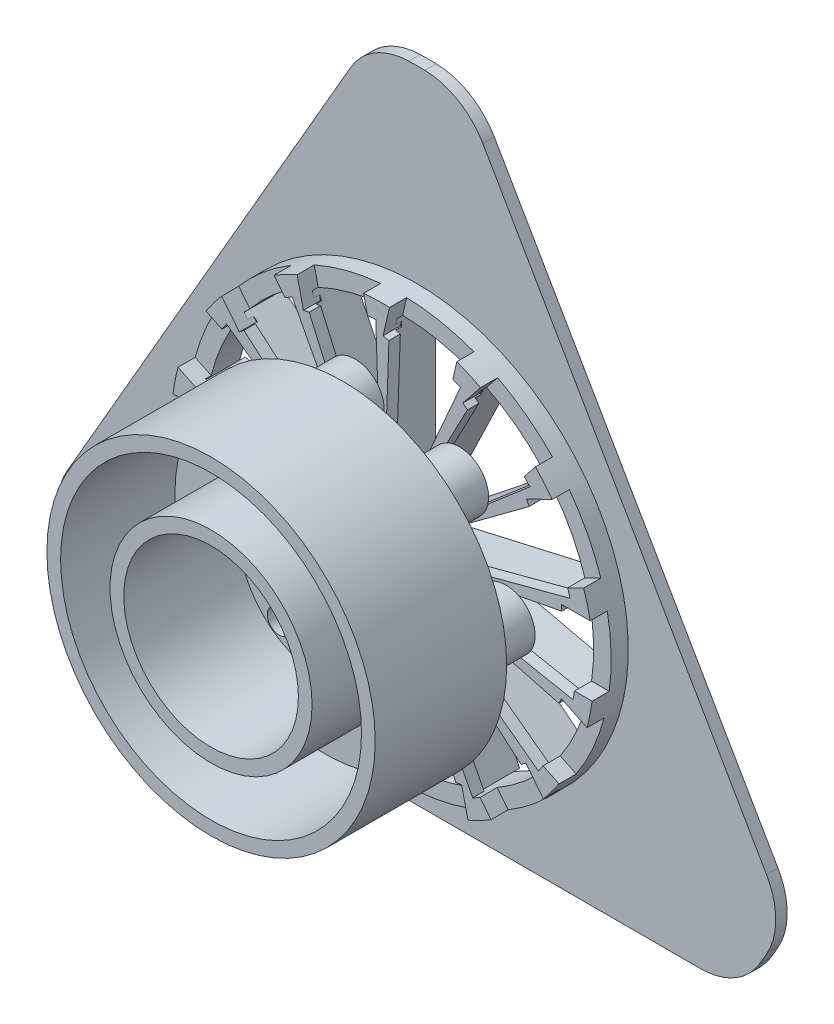
from build123d import *
from build123d.topology import SkipClean

# Parameters (mm, degrees)
SKETCH2_R               = 18.5
BOSS_EXTRUDE10_DEPTH    = 4
SKETCH8_R               = 22.678479032
SKETCH8_R_2             = 21.249376386
BOSS_EXTRUDE11_DEPTH    = 4
SKETCH9_R               = 1.624259049
SKETCH9_R_2             = 1.124259049
SKETCH9_R_3             = 2.552274029
SKETCH9_R_4             = 2.052274029
BOSS_EXTRUDE12_DEPTH    = 5
BOSS_EXTRUDE16_START    = -1.5
SKETCH11_R              = 14.361292765
SKETCH11_R_2            = 8.114913008
SKETCH11_R_3            = 2.552274029
SKETCH11_R_4            = 4.894571286
SKETCH11_R_5            = 2.052274029
BOSS_EXTRUDE16_DEPTH    = 1.5
SKETCH12_R              = 14.361292765
SKETCH12_R_2            = 13.161292765
SKETCH12_R_3            = 8.83789669
SKETCH12_R_4            = 7.63789669
BOSS_EXTRUDE14_DEPTH    = 10
SKETCH13_R              = 1.041112239
SKETCH13_R_2            = 1.221222972
CUT_EXTRUDE2_DEPTH      = 1.5
BOSS_EXTRUDE17_START    = -3
BOSS_EXTRUDE17_DEPTH    = 1
CUT_EXTRUDE4_START      = -2
SKETCH17_W              = 1.972139385
SKETCH17_H              = 6
CUT_EXTRUDE4_DEPTH      = 5
CIRPATTERN1_COUNT       = 14
CUT_EXTRUDE5_DEPTH      = 34.595041634
CUT_EXTRUDE5_DEPTH_BACK = 34.595041634
SKETCH18_R              = 22.678479032
SKETCH18_R_2            = 21.249376386
SKETCH19_R              = 22.100164657
SKETCH19_R_2            = 18.5
BOSS_EXTRUDE18_DEPTH    = 1
BOSS_EXTRUDE2_START     = -1
SKETCH3_R               = 35
SKETCH3_R_2             = 22.100164657
BOSS_EXTRUDE2_DEPTH     = 1
SKETCH4_R               = 2.9
BOSS_EXTRUDE3_DEPTH     = 2
SKETCH6_R               = 5
BOSS_EXTRUDE4_DEPTH     = 1
SKETCH7_R               = 59.131365533
CUT_EXTRUDE1_DEPTH      = 10
FILLET1_R               = 6
BOSS_EXTRUDE19_START    = -0.5
BOSS_EXTRUDE19_DEPTH    = 0.5
BOSS_EXTRUDE20_START    = 0.5
SKETCH21_R              = 3
BOSS_EXTRUDE20_DEPTH    = 0.5


with BuildPart() as part:
    # Sketch2 → Boss-Extrude10 (new body)
    with BuildSketch(Plane.XY.offset(10)):
        Circle(SKETCH2_R)
        with BuildLine():
            Line((-0.15, 16.969746557), (-0.15, 2.996247653))
            ThreePointArc((-0.15, 2.996247653), (-0.667562802, 2.924783737), (-1.164877805, 2.764608417))
            Line((-1.164877805, 2.764608417), (-7.227751758, 15.354295905))
            ThreePointArc((-7.227751758, 15.354295905), (-3.776271369, 16.544925891), (-0.15, 16.969746557))
        make_face(mode=Mode.SUBTRACT)
        with BuildLine():
            Line((-7.498042418, 15.224130783), (-1.435168465, 2.634443295))
            ThreePointArc((-1.435168465, 2.634443295), (-1.870469406, 2.345494447), (-2.249037274, 1.985404578))
            Line((-2.249037274, 1.985404578), (-13.173958637, 10.697738641))
            ThreePointArc((-13.173958637, 10.697738641), (-10.580877249, 13.268000408), (-7.498042418, 15.224130783))
        make_face(mode=Mode.SUBTRACT)
        with BuildLine():
            Line((-13.361005578, 10.463189196), (-2.436084215, 1.750855133))
            ThreePointArc((-2.436084215, 1.750855133), (-2.702906604, 1.301651217), (-2.887747329, 0.812967013))
            Line((-2.887747329, 0.812967013), (-16.510901441, 3.92236304))
            ThreePointArc((-16.510901441, 3.92236304), (-15.289810625, 7.363184723), (-13.361005578, 10.463189196))
        make_face(mode=Mode.SUBTRACT)
        with BuildLine():
            Line((-16.577657721, 3.629884666), (-2.954503609, 0.520488639))
            ThreePointArc((-2.954503609, 0.520488639), (-3, 0), (-2.954503609, -0.520488639))
            Line((-2.954503609, -0.520488639), (-16.577657721, -3.629884666))
            ThreePointArc((-16.577657721, -3.629884666), (-16.970409488, 0), (-16.577657721, 3.629884666))
        make_face(mode=Mode.SUBTRACT)
        with BuildLine():
            Line((-16.510901441, -3.92236304), (-2.887747329, -0.812967013))
            ThreePointArc((-2.887747329, -0.812967013), (-2.702906604, -1.301651217), (-2.436084215, -1.750855133))
            Line((-2.436084215, -1.750855133), (-13.361005578, -10.463189196))
            ThreePointArc((-13.361005578, -10.463189196), (-15.289810625, -7.363184723), (-16.510901441, -3.92236304))
        make_face(mode=Mode.SUBTRACT)
        with BuildLine():
            Line((-13.173958637, -10.697738641), (-2.249037274, -1.985404578))
            ThreePointArc((-2.249037274, -1.985404578), (-1.870469406, -2.345494447), (-1.435168465, -2.634443295))
            Line((-1.435168465, -2.634443295), (-7.498042418, -15.224130783))
            ThreePointArc((-7.498042418, -15.224130783), (-10.580877249, -13.268000408), (-13.173958637, -10.697738641))
        make_face(mode=Mode.SUBTRACT)
        with BuildLine():
            Line((-7.227751758, -15.354295905), (-1.164877805, -2.764608417))
            ThreePointArc((-1.164877805, -2.764608417), (-0.667562802, -2.924783737), (-0.15, -2.996247653))
            Line((-0.15, -2.996247653), (-0.15, -16.969746557))
            ThreePointArc((-0.15, -16.969746557), (-3.776271369, -16.544925891), (-7.227751758, -15.354295905))
        make_face(mode=Mode.SUBTRACT)
        with BuildLine():
            Line((0.15, -16.969746557), (0.15, -2.996247653))
            ThreePointArc((0.15, -2.996247653), (0.667562802, -2.924783737), (1.164877805, -2.764608417))
            Line((1.164877805, -2.764608417), (7.227751758, -15.354295905))
            ThreePointArc((7.227751758, -15.354295905), (3.776271369, -16.544925891), (0.15, -16.969746557))
        make_face(mode=Mode.SUBTRACT)
        with BuildLine():
            Line((7.498042418, -15.224130783), (1.435168465, -2.634443295))
            ThreePointArc((1.435168465, -2.634443295), (1.870469406, -2.345494447), (2.249037274, -1.985404578))
            Line((2.249037274, -1.985404578), (13.173958637, -10.697738641))
            ThreePointArc((13.173958637, -10.697738641), (10.580877249, -13.268000408), (7.498042418, -15.224130783))
        make_face(mode=Mode.SUBTRACT)
        with BuildLine():
            Line((13.361005578, -10.463189196), (2.436084215, -1.750855133))
            ThreePointArc((2.436084215, -1.750855133), (2.702906604, -1.301651217), (2.887747329, -0.812967013))
            Line((2.887747329, -0.812967013), (16.510901441, -3.92236304))
            ThreePointArc((16.510901441, -3.92236304), (15.289810625, -7.363184723), (13.361005578, -10.463189196))
        make_face(mode=Mode.SUBTRACT)
        with BuildLine():
            Line((16.577657721, -3.629884666), (2.954503609, -0.520488639))
            ThreePointArc((2.954503609, -0.520488639), (3, 0), (2.954503609, 0.520488639))
            Line((2.954503609, 0.520488639), (16.577657721, 3.629884666))
            ThreePointArc((16.577657721, 3.629884666), (16.970409488, 0), (16.577657721, -3.629884666))
        make_face(mode=Mode.SUBTRACT)
        with BuildLine():
            Line((16.510901441, 3.92236304), (2.887747329, 0.812967013))
            ThreePointArc((2.887747329, 0.812967013), (2.702906604, 1.301651217), (2.436084215, 1.750855133))
            Line((2.436084215, 1.750855133), (13.361005578, 10.463189196))
            ThreePointArc((13.361005578, 10.463189196), (15.289810625, 7.363184723), (16.510901441, 3.92236304))
        make_face(mode=Mode.SUBTRACT)
        with BuildLine():
            Line((13.173958637, 10.697738641), (2.249037274, 1.985404578))
            ThreePointArc((2.249037274, 1.985404578), (1.870469406, 2.345494447), (1.435168465, 2.634443295))
            Line((1.435168465, 2.634443295), (7.498042418, 15.224130783))
            ThreePointArc((7.498042418, 15.224130783), (10.580877249, 13.268000408), (13.173958637, 10.697738641))
        make_face(mode=Mode.SUBTRACT)
        with BuildLine():
            Line((7.227751758, 15.354295905), (1.164877805, 2.764608417))
            ThreePointArc((1.164877805, 2.764608417), (0.667562802, 2.924783737), (0.15, 2.996247653))
            Line((0.15, 2.996247653), (0.15, 16.969746557))
            ThreePointArc((0.15, 16.969746557), (3.776271369, 16.544925891), (7.227751758, 15.354295905))
        make_face(mode=Mode.SUBTRACT)
    extrude(amount=BOSS_EXTRUDE10_DEPTH)

    # Sketch9 → Boss-Extrude12 (add)
    # profile 1 of 14: a face of its own
    with BuildSketch(Plane.XY.offset(14)):
        with Locations(Location((1.474259049, 6.459150925, 0), (0, 0, 180))):
            Circle(SKETCH9_R)
        with Locations((1.474259049, 6.459150925)):
            Circle(SKETCH9_R_2, mode=Mode.SUBTRACT)
    # profile 2 of 14: a face of its own
    with BuildSketch(Plane.XY.offset(14)):
        with Locations(Location((6.731022253, 8.440434938, 0), (0, 0, 182.345436186))):
            Circle(SKETCH9_R_3)
        with Locations((6.731022253, 8.440434938)):
            Circle(SKETCH9_R_4, mode=Mode.SUBTRACT)
    # profile 3 of 14: a face of its own
    with BuildSketch(Plane.XY.offset(14)):
        with Locations((-2.402274029, 10.525050214)):
            Circle(SKETCH9_R_3)
        with Locations((-2.402274029, 10.525050214)):
            Circle(SKETCH9_R_4, mode=Mode.SUBTRACT)
    # profile 4 of 14: a face of its own
    with BuildSketch(Plane.XY.offset(14)):
        with Locations(Location((-4.130782061, 5.179836868, 0), (0, 0, 196.045646816))):
            Circle(SKETCH9_R)
        with Locations((-4.130782061, 5.179836868)):
            Circle(SKETCH9_R_2, mode=Mode.SUBTRACT)
    # profile 5 of 14: a face of its own
    with BuildSketch(Plane.XY.offset(14)):
        with Locations(Location((-9.72660897, 4.684088007, 0), (0, 0, 229.083135243))):
            Circle(SKETCH9_R_3)
        with Locations((-9.72660897, 4.684088007)):
            Circle(SKETCH9_R_4, mode=Mode.SUBTRACT)
    # profile 6 of 14: a face of its own
    with BuildSketch(Plane.XY.offset(14)):
        with Locations(Location((-6.625260026, 0, 0), (0, 0, 112.525781755))):
            Circle(SKETCH9_R)
        with Locations((-6.625260026, 0)):
            Circle(SKETCH9_R_2, mode=Mode.SUBTRACT)
    # profile 7 of 14: a face of its own
    with BuildSketch(Plane.XY.offset(14)):
        with Locations(Location((-9.72660897, -4.684088007, 0), (0, 0, 130.916864757))):
            Circle(SKETCH9_R_3)
        with Locations((-9.72660897, -4.684088007)):
            Circle(SKETCH9_R_4, mode=Mode.SUBTRACT)
    # profile 8 of 14: a face of its own
    with BuildSketch(Plane.XY.offset(14)):
        with Locations(Location((-4.130782061, -5.179836868, 0), (0, 0, 163.954353184))):
            Circle(SKETCH9_R)
        with Locations((-4.130782061, -5.179836868)):
            Circle(SKETCH9_R_2, mode=Mode.SUBTRACT)
    # profile 9 of 14: a face of its own
    with BuildSketch(Plane.XY.offset(14)):
        with Locations((-2.402274029, -10.525050214)):
            Circle(SKETCH9_R_3)
        with Locations((-2.402274029, -10.525050214)):
            Circle(SKETCH9_R_4, mode=Mode.SUBTRACT)
    # profile 10 of 14: a face of its own
    with BuildSketch(Plane.XY.offset(14)):
        with Locations(Location((6.731022253, -8.440434938, 0), (0, 0, 177.654563814))):
            Circle(SKETCH9_R_3)
        with Locations((6.731022253, -8.440434938)):
            Circle(SKETCH9_R_4, mode=Mode.SUBTRACT)
    # profile 11 of 14: a face of its own
    with BuildSketch(Plane.XY.offset(14)):
        with Locations(Location((5.969153026, -2.874592593, 0), (0, 0, 196.045646816))):
            Circle(SKETCH9_R)
        with Locations((5.969153026, -2.874592593)):
            Circle(SKETCH9_R_2, mode=Mode.SUBTRACT)
    # profile 12 of 14: a face of its own
    with BuildSketch(Plane.XY.offset(14)):
        with Locations(Location((1.474259049, -6.459150925, 0), (0, 0, 180))):
            Circle(SKETCH9_R)
        with Locations((1.474259049, -6.459150925)):
            Circle(SKETCH9_R_2, mode=Mode.SUBTRACT)
    # profile 13 of 14: a face of its own
    with BuildSketch(Plane.XY.offset(14)):
        with Locations(Location((5.969153026, 2.874592593, 0), (0, 0, 163.954353184))):
            Circle(SKETCH9_R)
        with Locations((5.969153026, 2.874592593)):
            Circle(SKETCH9_R_2, mode=Mode.SUBTRACT)
    # profile 14 of 14: a face of its own
    with BuildSketch(Plane.XY.offset(14)):
        with Locations(Location((10.795721491, 0, 0), (0, 0, 229.083135243))):
            Circle(SKETCH9_R_3)
        with Locations((10.795721491, 0)):
            Circle(SKETCH9_R_4, mode=Mode.SUBTRACT)
    extrude(amount=BOSS_EXTRUDE12_DEPTH)

    # Sketch11 → Boss-Extrude16 (add)
    # profile 1 of 4: a face of its own
    with BuildSketch(Plane.XY.offset(19).offset(BOSS_EXTRUDE16_START)):
        Circle(SKETCH11_R)
        Circle(SKETCH11_R_2, mode=Mode.SUBTRACT)
        with Locations(Location((10.795721491, 0, 0), (0, 0, 229.083135243))):
            Circle(SKETCH11_R_3, mode=Mode.SUBTRACT)
    # profile 2 of 4: a face of its own
    with BuildSketch(Plane.XY.offset(19).offset(BOSS_EXTRUDE16_START)):
        Circle(SKETCH11_R_2)
        Circle(SKETCH11_R_4, mode=Mode.SUBTRACT)
    # profile 3 of 4: a face of its own
    with BuildSketch(Plane.XY.offset(19).offset(BOSS_EXTRUDE16_START)):
        Circle(SKETCH11_R_4)
    # profile 4 of 4: a face of its own
    with BuildSketch(Plane.XY.offset(19).offset(BOSS_EXTRUDE16_START)):
        with Locations((10.795721491, 0)):
            Circle(SKETCH11_R_5)
    extrude(amount=BOSS_EXTRUDE16_DEPTH)

    # Sketch12 → Boss-Extrude14 (add)
    # profile 1 of 2: a face of its own
    with BuildSketch(Plane.XY.offset(19)):
        Circle(SKETCH12_R)
        Circle(SKETCH12_R_2, mode=Mode.SUBTRACT)
    # profile 2 of 2: a face of its own
    with BuildSketch(Plane.XY.offset(19)):
        Circle(SKETCH12_R_3)
        Circle(SKETCH12_R_4, mode=Mode.SUBTRACT)
    extrude(amount=BOSS_EXTRUDE14_DEPTH)

    # Sketch13 → Cut-Extrude2 (cut)
    with BuildSketch(Plane.XY.offset(19)):
        with Locations((1.414035578, 6.363318005)):
            Circle(SKETCH13_R)
        with Locations((5.856679112, 2.86192635)):
            Circle(SKETCH13_R)
        with Locations((5.88912382, -2.79455422)):
            Circle(SKETCH13_R)
        with Locations((1.486938175, -6.346678463)):
            Circle(SKETCH13_R)
        with Locations((-4.034942243, -5.119624375)):
            Circle(SKETCH13_R)
        with Locations((-6.518428855, -0.037388711)):
            Circle(SKETCH13_R)
        with Locations((-4.093405587, 5.073001415)):
            Circle(SKETCH13_R)
        with Locations((-2.402274029, 10.525050214)):
            Circle(SKETCH13_R_2)
        with Locations((6.819905417, 8.551890899)):
            Circle(SKETCH13_R_2)
        with Locations((11.02716218, 0.111455962)):
            Circle(SKETCH13_R_2)
        with Locations((7.051346107, -8.440434938)):
            Circle(SKETCH13_R_2)
        with Locations((-2.113672209, -10.664033525)):
            Circle(SKETCH13_R_2)
        with Locations((-9.566447043, -4.884924711)):
            Circle(SKETCH13_R_2)
        with Locations((-9.694886936, 4.545104696)):
            Circle(SKETCH13_R_2)
    extrude(amount=-CUT_EXTRUDE2_DEPTH, mode=Mode.SUBTRACT)

    # Sketch16 → Boss-Extrude17 (add)
    with BuildSketch(Plane(origin=(0, 0, 10), x_dir=(-1, 0, 0), z_dir=(0, 0, -1)).offset(BOSS_EXTRUDE17_START)):
        with BuildLine():
            ThreePointArc((-7.892305965, 15.023525044), (-7.363184723, 15.289810625), (-6.825092574, 15.537467926))
            Line((-6.825092574, 15.537467926), (0, 0))
            Line((0, 0), (-7.892305965, 15.023525044))
        make_face()
        with BuildLine():
            ThreePointArc((-0.59225875, 16.960071573), (0, 16.970409488), (0.59225875, 16.960071573))
            Line((0.59225875, 16.960071573), (0, 0))
            Line((0, 0), (-0.59225875, 16.960071573))
        make_face()
        with BuildLine():
            ThreePointArc((6.825092574, 15.537467926), (7.363184723, 15.289810625), (7.892305965, 15.023525044))
            Line((7.892305965, 15.023525044), (0, 0))
            Line((0, 0), (6.825092574, 15.537467926))
        make_face()
        with BuildLine():
            ThreePointArc((12.89065061, 11.037478201), (13.268000408, 10.580877249), (13.629185192, 10.111385128))
            Line((13.629185192, 10.111385128), (0, 0))
            Line((0, 0), (12.89065061, 11.037478201))
        make_face()
        with BuildLine():
            ThreePointArc((16.403057199, 4.351380553), (16.544925891, 3.776271369), (16.66663714, 3.19656138))
            Line((16.66663714, 3.19656138), (0, 0))
            Line((0, 0), (16.403057199, 4.351380553))
        make_face()
        with BuildLine():
            ThreePointArc((16.66663714, -3.19656138), (16.544925891, -3.776271369), (16.403057199, -4.351380553))
            Line((16.403057199, -4.351380553), (0, 0))
            Line((0, 0), (16.66663714, -3.19656138))
        make_face()
        with BuildLine():
            ThreePointArc((13.629185192, -10.111385128), (13.268000408, -10.580877249), (12.89065061, -11.037478201))
            Line((12.89065061, -11.037478201), (0, 0))
            Line((0, 0), (13.629185192, -10.111385128))
        make_face()
        with BuildLine():
            ThreePointArc((7.892305965, -15.023525044), (7.363184723, -15.289810625), (6.825092574, -15.537467926))
            Line((6.825092574, -15.537467926), (0, 0))
            Line((0, 0), (7.892305965, -15.023525044))
        make_face()
        with BuildLine():
            ThreePointArc((0.59225875, -16.960071573), (0, -16.970409488), (-0.59225875, -16.960071573))
            Line((-0.59225875, -16.960071573), (0, 0))
            Line((0, 0), (0.59225875, -16.960071573))
        make_face()
        with BuildLine():
            ThreePointArc((-6.825092574, -15.537467926), (-7.363184723, -15.289810625), (-7.892305965, -15.023525044))
            Line((-7.892305965, -15.023525044), (0, 0))
            Line((0, 0), (-6.825092574, -15.537467926))
        make_face()
        with BuildLine():
            ThreePointArc((-16.403057199, -4.351380553), (-16.544925891, -3.776271369), (-16.66663714, -3.19656138))
            Line((-16.66663714, -3.19656138), (0, 0))
            Line((0, 0), (-16.403057199, -4.351380553))
        make_face()
        with BuildLine():
            ThreePointArc((-12.89065061, -11.037478201), (-13.268000408, -10.580877249), (-13.629185192, -10.111385128))
            Line((-13.629185192, -10.111385128), (0, 0))
            Line((0, 0), (-12.89065061, -11.037478201))
        make_face()
        with BuildLine():
            ThreePointArc((-16.66663714, 3.19656138), (-16.544925891, 3.776271369), (-16.403057199, 4.351380553))
            Line((-16.403057199, 4.351380553), (0, 0))
            Line((0, 0), (-16.66663714, 3.19656138))
        make_face()
        with BuildLine():
            ThreePointArc((-13.629185192, 10.111385128), (-13.268000408, 10.580877249), (-12.89065061, 11.037478201))
            Line((-12.89065061, 11.037478201), (0, 0))
            Line((0, 0), (-13.629185192, 10.111385128))
        make_face()
    extrude(amount=-BOSS_EXTRUDE17_DEPTH)

    # Sketch17 → Cut-Extrude4 (cut)
    with BuildSketch(Plane(origin=(22.678479032, 0, 0), x_dir=(0, 0, -1), z_dir=(1, 0, 0)).offset(CUT_EXTRUDE4_START)):
        with Locations((-13.486069692, 0.520488639)):
            Rectangle(SKETCH17_W, SKETCH17_H)
    cut_extrude4 = extrude(amount=-CUT_EXTRUDE4_DEPTH, mode=Mode.SUBTRACT)

    # CirPattern1: Cut-Extrude4 ×14 about axis
    cirpattern1_axis = Axis((0, 0, 0), (0, 0, 1))
    for i in range(1, CIRPATTERN1_COUNT):
        add(cut_extrude4.rotate(cirpattern1_axis, i * 360 / CIRPATTERN1_COUNT), mode=Mode.SUBTRACT)

    # Sketch19 → Boss-Extrude18 (add)
    with BuildSketch(Plane(origin=(0, 0, 10), x_dir=(-1, 0, 0), z_dir=(0, 0, -1))):
        Circle(SKETCH19_R)
        Circle(SKETCH19_R_2, mode=Mode.SUBTRACT)
    extrude(amount=-BOSS_EXTRUDE18_DEPTH)

    # Sketch3 → Boss-Extrude2 (add)
    with BuildSketch(Plane.XY.offset(11).offset(BOSS_EXTRUDE2_START)):
        Circle(SKETCH3_R)
        Circle(SKETCH3_R_2, mode=Mode.SUBTRACT)
    extrude(amount=BOSS_EXTRUDE2_DEPTH)

    # Sketch4 → Boss-Extrude3 (add)
    with BuildSketch(Plane(origin=(0, 0, 10), x_dir=(-1, 0, 0), z_dir=(0, 0, -1))):
        with Locations(Location((0, 29, 0), (0, 0, 180))):
            Circle(SKETCH4_R)
        with Locations(Location((25.11473671, -14.5, 0), (0, 0, 180))):
            Circle(SKETCH4_R)
        with Locations(Location((-25.11473671, -14.5, 0), (0, 0, 180))):
            Circle(SKETCH4_R)
    extrude(amount=BOSS_EXTRUDE3_DEPTH)

    # Sketch6 → Boss-Extrude4 (add)
    with BuildSketch(Plane.XY.offset(10)):
        with Locations((0, 30)):
            Circle(SKETCH6_R)
        with Locations((25.980762114, -15)):
            Circle(SKETCH6_R)
        with Locations((-25.980762114, -15)):
            Circle(SKETCH6_R)
    extrude(amount=BOSS_EXTRUDE4_DEPTH)

    # Sketch7 → Cut-Extrude1 (cut)
    with BuildSketch(Plane(origin=(0, 0, 8), x_dir=(-1, 0, 0), z_dir=(0, 0, -1))):
        Circle(SKETCH7_R)
        Polygon((0, 42), (-36.373066959, -21), (36.373066959, -21), align=None, mode=Mode.SUBTRACT)
    extrude(amount=-CUT_EXTRUDE1_DEPTH, mode=Mode.SUBTRACT)

    # Fillet1
    fillet1_edges = [part.edges().sort_by_distance(p)[0] for p in [
        (32.186533479, -13.748711306, 10.5),
        (4.186533479, 34.748711306, 10.5),
        (-28, -21, 10.5),
        (28, -21, 10.5),
        (-4.186533479, 34.748711306, 10.5),
        (-32.186533479, -13.748711306, 10.5),
    ]]
    fillet(fillet1_edges, radius=FILLET1_R)

    # Sketch20 → Boss-Extrude19 (add)
    with BuildSketch(Plane.XY.offset(10).offset(BOSS_EXTRUDE19_START)):
        with BuildLine():
            ThreePointArc((0.15, 16.969746557), (0, 16.970409488), (-0.15, 16.969746557))
            Line((-0.15, 16.969746557), (-0.15, 0.683739717))
            ThreePointArc((-0.15, 0.683739717), (0, 0.7), (0.15, 0.683739717))
            Line((0.15, 0.683739717), (0.15, 16.969746557))
        make_face()
        with BuildLine():
            Line((-0.161518215, 0.681110759), (-7.227751758, 15.354295905))
            ThreePointArc((-7.227751758, 15.354295905), (-7.363184723, 15.289810625), (-7.498042418, 15.224130783))
            Line((-7.498042418, 15.224130783), (-0.431808875, 0.550945638))
            ThreePointArc((-0.431808875, 0.550945638), (-0.303718617, 0.630678208), (-0.161518215, 0.681110759))
        make_face()
        with BuildLine():
            ThreePointArc((7.498042418, 15.224130783), (7.363184723, 15.289810625), (7.227751758, 15.354295905))
            Line((7.227751758, 15.354295905), (0.161518215, 0.681110759))
            ThreePointArc((0.161518215, 0.681110759), (0.303718617, 0.630678208), (0.431808875, 0.550945638))
            Line((0.431808875, 0.550945638), (7.498042418, 15.224130783))
        make_face()
        with BuildLine():
            Line((-0.441045766, 0.543579463), (-13.173958637, 10.697738641))
            ThreePointArc((-13.173958637, 10.697738641), (-13.268000408, 10.580877249), (-13.361005578, 10.463189196))
            Line((-13.361005578, 10.463189196), (-0.628092706, 0.309030018))
            ThreePointArc((-0.628092706, 0.309030018), (-0.547282038, 0.436442861), (-0.441045766, 0.543579463))
        make_face()
        with BuildLine():
            ThreePointArc((13.361005578, 10.463189196), (13.268000408, 10.580877249), (13.173958637, 10.697738641))
            Line((13.173958637, 10.697738641), (0.441045766, 0.543579463))
            ThreePointArc((0.441045766, 0.543579463), (0.547282038, 0.436442861), (0.628092706, 0.309030018))
            Line((0.628092706, 0.309030018), (13.361005578, 10.463189196))
        make_face()
        with BuildLine():
            Line((-0.633218794, 0.298385587), (-16.510901441, 3.92236304))
            ThreePointArc((-16.510901441, 3.92236304), (-16.544925891, 3.776271369), (-16.577657721, 3.629884666))
            Line((-16.577657721, 3.629884666), (-0.699975074, 0.005907213))
            ThreePointArc((-0.699975074, 0.005907213), (-0.682449539, 0.155764654), (-0.633218794, 0.298385587))
        make_face()
        with BuildLine():
            ThreePointArc((16.577657721, 3.629884666), (16.544925891, 3.776271369), (16.510901441, 3.92236304))
            Line((16.510901441, 3.92236304), (0.633218794, 0.298385587))
            ThreePointArc((0.633218794, 0.298385587), (0.682449539, 0.155764654), (0.699975074, 0.005907213))
            Line((0.699975074, 0.005907213), (16.577657721, 3.629884666))
        make_face()
        with BuildLine():
            Line((-0.699975074, -0.005907213), (-16.577657721, -3.629884666))
            ThreePointArc((-16.577657721, -3.629884666), (-16.544925891, -3.776271369), (-16.510901441, -3.92236304))
            Line((-16.510901441, -3.92236304), (-0.633218794, -0.298385587))
            ThreePointArc((-0.633218794, -0.298385587), (-0.682449539, -0.155764654), (-0.699975074, -0.005907213))
        make_face()
        with BuildLine():
            ThreePointArc((16.510901441, -3.92236304), (16.544925891, -3.776271369), (16.577657721, -3.629884666))
            Line((16.577657721, -3.629884666), (0.699975074, -0.005907213))
            ThreePointArc((0.699975074, -0.005907213), (0.682449539, -0.155764654), (0.633218794, -0.298385587))
            Line((0.633218794, -0.298385587), (16.510901441, -3.92236304))
        make_face()
        with BuildLine():
            Line((-0.628092706, -0.309030018), (-13.361005578, -10.463189196))
            ThreePointArc((-13.361005578, -10.463189196), (-13.268000408, -10.580877249), (-13.173958637, -10.697738641))
            Line((-13.173958637, -10.697738641), (-0.441045766, -0.543579463))
            ThreePointArc((-0.441045766, -0.543579463), (-0.547282038, -0.436442861), (-0.628092706, -0.309030018))
        make_face()
        with BuildLine():
            ThreePointArc((13.173958637, -10.697738641), (13.268000408, -10.580877249), (13.361005578, -10.463189196))
            Line((13.361005578, -10.463189196), (0.628092706, -0.309030018))
            ThreePointArc((0.628092706, -0.309030018), (0.547282038, -0.436442861), (0.441045766, -0.543579463))
            Line((0.441045766, -0.543579463), (13.173958637, -10.697738641))
        make_face()
        with BuildLine():
            Line((-0.431808875, -0.550945638), (-7.498042418, -15.224130783))
            ThreePointArc((-7.498042418, -15.224130783), (-7.363184723, -15.289810625), (-7.227751758, -15.354295905))
            Line((-7.227751758, -15.354295905), (-0.161518215, -0.681110759))
            ThreePointArc((-0.161518215, -0.681110759), (-0.303718617, -0.630678208), (-0.431808875, -0.550945638))
        make_face()
        with BuildLine():
            ThreePointArc((7.227751758, -15.354295905), (7.363184723, -15.289810625), (7.498042418, -15.224130783))
            Line((7.498042418, -15.224130783), (0.431808875, -0.550945638))
            ThreePointArc((0.431808875, -0.550945638), (0.303718617, -0.630678208), (0.161518215, -0.681110759))
            Line((0.161518215, -0.681110759), (7.227751758, -15.354295905))
        make_face()
        with BuildLine():
            Line((-0.15, -0.683739717), (-0.15, -16.969746557))
            ThreePointArc((-0.15, -16.969746557), (0, -16.970409488), (0.15, -16.969746557))
            Line((0.15, -16.969746557), (0.15, -0.683739717))
            ThreePointArc((0.15, -0.683739717), (0, -0.7), (-0.15, -0.683739717))
        make_face()
    extrude(amount=BOSS_EXTRUDE19_DEPTH)

    # Sketch21 → Boss-Extrude20 (add)
    with SkipClean():  # the faces are left unmerged after this step: merging them gives an invalid solid
        with BuildSketch(Plane(origin=(0, 0, 10), x_dir=(-1, 0, 0), z_dir=(0, 0, -1)).offset(BOSS_EXTRUDE20_START)):
            Circle(SKETCH21_R)
        extrude(amount=-BOSS_EXTRUDE20_DEPTH)


with BuildPart() as body_2:
    # Sketch8 → Boss-Extrude11 (new body)
    with BuildSketch(Plane.XY.offset(14)):
        Circle(SKETCH8_R)
        Circle(SKETCH8_R_2, mode=Mode.SUBTRACT)
    extrude(amount=-BOSS_EXTRUDE11_DEPTH)

    # Sketch18 → Cut-Extrude5 (cut, two sides: drawn at the far end of the back side and taken through both)
    with BuildSketch(Plane.XY.offset(19).offset(-CUT_EXTRUDE5_DEPTH_BACK)):
        Circle(SKETCH18_R)
        Circle(SKETCH18_R_2, mode=Mode.SUBTRACT)
    extrude(amount=CUT_EXTRUDE5_DEPTH + CUT_EXTRUDE5_DEPTH_BACK, mode=Mode.SUBTRACT)


solid = part.part
